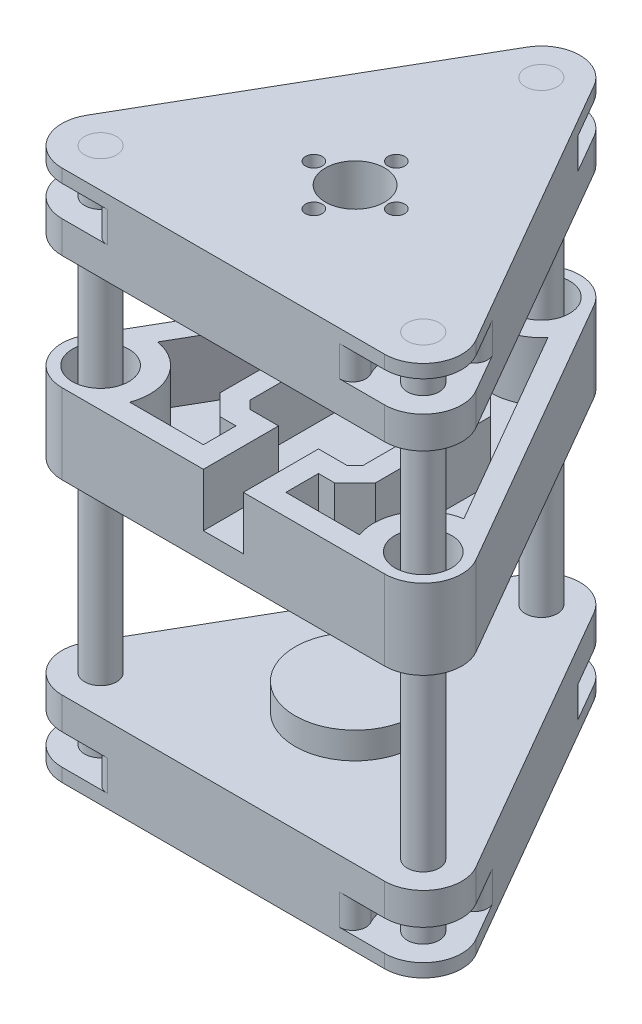
from build123d import *

# Parameters (mm, degrees)
SKETCH1_R             = 6
BOSS_EXTRUDE1_DEPTH   = 5
BOSS_EXTRUDE2_START   = 5
BOSS_EXTRUDE2_DEPTH   = 11.5
BOSS_EXTRUDE6_START   = 16.5
SKETCH1_5_R           = 6
BOSS_EXTRUDE6_DEPTH   = 12
SKETCH1_3_R           = 6
BOSS_EXTRUDE3_DEPTH   = 200
BOSS_EXTRUDE3_2_DEPTH = 200
BOSS_EXTRUDE3_3_DEPTH = 200
FILLET1_START         = 5
FILLET1_DEPTH         = 11.5
SKETCH2_R             = 22.5
BOSS_EXTRUDE4_DEPTH   = 10
SKETCH3_R             = 22.15
SKETCH3_R_2           = 11.15
SKETCH3_R_3           = 3.15
CUT_EXTRUDE1_DEPTH    = 6
SKETCH3_2_R           = 3.15
SKETCH3_2_R_2         = 11.15
CUT_EXTRUDE2_DEPTH    = 206.416118086
SKETCH4_R             = 10.6
BOSS_EXTRUDE7_DEPTH   = 30
SKETCH5_W             = 15
SKETCH5_H             = 28.25
CUT_EXTRUDE3_DEPTH    = 20
CHAMFER1_SIZE         = 3
SHELL2_START          = 106.5
SHELL2_DEPTH          = 22
BOSS_EXTRUDE8_START   = 10
SKETCH6_R             = 22.5
BOSS_EXTRUDE8_DEPTH   = 10


with BuildPart() as part:
    # Sketch1 → Boss-Extrude1 (new body)
    with BuildSketch(Plane(origin=(0, 0, 0), x_dir=(1, 0, 0), z_dir=(0, 1, 0))):
        with BuildLine():
            Line((-12.557368355, 77.25), (-73.17914662, -27.75))
            ThreePointArc((-73.17914662, -27.75), (-73.17914662, -42.25), (-60.621778265, -49.5))
            Line((-60.621778265, -49.5), (60.621778265, -49.5))
            ThreePointArc((60.621778265, -49.5), (73.17914662, -42.25), (73.17914662, -27.75))
            Line((73.17914662, -27.75), (12.557368355, 77.25))
            ThreePointArc((12.557368355, 77.25), (0, 84.5), (-12.557368355, 77.25))
        make_face()
        with Locations(Location((0, 70, 0), (0, 0, 270))):
            Circle(SKETCH1_R, mode=Mode.SUBTRACT)
        with Locations(Location((60.621778265, -35, 0), (0, 0, 270))):
            Circle(SKETCH1_R, mode=Mode.SUBTRACT)
        with Locations(Location((-60.621778265, -35, 0), (0, 0, 270))):
            Circle(SKETCH1_R, mode=Mode.SUBTRACT)
    extrude(amount=BOSS_EXTRUDE1_DEPTH)

    # Sketch1<2> → Boss-Extrude2 (add)
    with BuildSketch(Plane(origin=(0, 0, 0), x_dir=(1, 0, 0), z_dir=(0, 1, 0)).offset(BOSS_EXTRUDE2_START)):
        with BuildLine():
            ThreePointArc((14.5, 70), (-3.752876154, 55.994075519), (-12.557368355, 77.25))
            Line((-12.557368355, 77.25), (-73.17914662, -27.75))
            ThreePointArc((-73.17914662, -27.75), (-56.868902111, -20.994075519), (-46.121778265, -35))
            ThreePointArc((-46.121778265, -35), (-50.368729938, -45.253048327), (-60.621778265, -49.5))
            Line((-60.621778265, -49.5), (60.621778265, -49.5))
            ThreePointArc((60.621778265, -49.5), (48.06440991, -27.75), (73.17914662, -27.75))
            Line((73.17914662, -27.75), (12.557368355, 77.25))
            ThreePointArc((12.557368355, 77.25), (14.005924481, 73.752876154), (14.5, 70))
        make_face()
    extrude(amount=BOSS_EXTRUDE2_DEPTH)

    # Sketch1<5> → Boss-Extrude6 (add)
    with BuildSketch(Plane(origin=(0, 0, 0), x_dir=(1, 0, 0), z_dir=(0, 1, 0)).offset(BOSS_EXTRUDE6_START)):
        with BuildLine():
            Line((-12.557368355, 77.25), (-73.17914662, -27.75))
            ThreePointArc((-73.17914662, -27.75), (-73.17914662, -42.25), (-60.621778265, -49.5))
            Line((-60.621778265, -49.5), (60.621778265, -49.5))
            ThreePointArc((60.621778265, -49.5), (73.17914662, -42.25), (73.17914662, -27.75))
            Line((73.17914662, -27.75), (12.557368355, 77.25))
            ThreePointArc((12.557368355, 77.25), (0, 84.5), (-12.557368355, 77.25))
        make_face()
        with Locations(Location((0, 70, 0), (0, 0, 270))):
            Circle(SKETCH1_5_R, mode=Mode.SUBTRACT)
        with Locations(Location((60.621778265, -35, 0), (0, 0, 270))):
            Circle(SKETCH1_5_R, mode=Mode.SUBTRACT)
        with Locations(Location((-60.621778265, -35, 0), (0, 0, 270))):
            Circle(SKETCH1_5_R, mode=Mode.SUBTRACT)
    extrude(amount=BOSS_EXTRUDE6_DEPTH)

    # Fillet1: read off the stored shape, not the designer's step
    # Fillet1 outline → Fillet1 (cut)
    with BuildSketch(Plane(origin=(0, 0, 0), x_dir=(1, 0, 0), z_dir=(0, 1, 0)).offset(FILLET1_START)):
        with BuildLine():
            ThreePointArc((60.621778265, -49.5), (53.279417854, -47.503589228), (47.958901224, -42.064102564))
            ThreePointArc((47.958901224, -42.064102564), (47.903974391, -47.031848418), (43.592391899, -49.5))
            Line((43.592391899, -49.5), (60.621778265, -49.5))
        make_face()
        with BuildLine():
            ThreePointArc((64.664453437, -13.002118796), (64.682762712, -17.970134556), (60.40803202, -20.501575515))
            ThreePointArc((60.40803202, -20.501575515), (67.77902397, -22.389534746), (73.17914662, -27.75))
            Line((73.17914662, -27.75), (64.664453437, -13.002118796))
        make_face()
        with BuildLine():
            Line((-60.621778265, -49.5), (-43.592391899, -49.5))
            ThreePointArc((-43.592391899, -49.5), (-47.903974391, -47.031848418), (-47.958901224, -42.064102564))
            ThreePointArc((-47.958901224, -42.064102564), (-53.279417854, -47.503589228), (-60.621778265, -49.5))
        make_face()
        with BuildLine():
            ThreePointArc((12.449130796, 62.565678079), (16.778788321, 65.001982974), (21.072061538, 62.502118796))
            Line((21.072061538, 62.502118796), (12.557368355, 77.25))
            ThreePointArc((12.557368355, 77.25), (14.499606116, 69.893123974), (12.449130796, 62.565678079))
        make_face()
        with BuildLine():
            ThreePointArc((-73.17914662, -27.75), (-67.77902397, -22.389534746), (-60.40803202, -20.501575515))
            ThreePointArc((-60.40803202, -20.501575515), (-64.682762712, -17.970134556), (-64.664453437, -13.002118796))
            Line((-64.664453437, -13.002118796), (-73.17914662, -27.75))
        make_face()
        with BuildLine():
            ThreePointArc((-21.072061538, 62.502118796), (-16.778788321, 65.001982974), (-12.449130796, 62.565678079))
            ThreePointArc((-12.449130796, 62.565678079), (-14.499606116, 69.893123974), (-12.557368355, 77.25))
            Line((-12.557368355, 77.25), (-21.072061538, 62.502118796))
        make_face()
    extrude(amount=FILLET1_DEPTH, mode=Mode.SUBTRACT)


with BuildPart() as body_2:
    # Sketch1<3> → Boss-Extrude3 (new body)
    with BuildSketch(Plane(origin=(0, 0, 0), x_dir=(1, 0, 0), z_dir=(0, 1, 0))):
        with Locations(Location((0, 70, 0), (0, 0, 270))):
            Circle(SKETCH1_3_R)
    extrude(amount=BOSS_EXTRUDE3_DEPTH)


with BuildPart() as body_3:
    # Sketch1<3> → Boss-Extrude3 2 (new body)
    with BuildSketch(Plane(origin=(0, 0, 0), x_dir=(1, 0, 0), z_dir=(0, 1, 0))):
        with Locations(Location((60.621778265, -35, 0), (0, 0, 270))):
            Circle(SKETCH1_3_R)
    extrude(amount=BOSS_EXTRUDE3_2_DEPTH)


with BuildPart() as body_4:
    # Sketch1<3> → Boss-Extrude3 3 (new body)
    with BuildSketch(Plane(origin=(0, 0, 0), x_dir=(1, 0, 0), z_dir=(0, 1, 0))):
        with Locations(Location((-60.621778265, -35, 0), (0, 0, 270))):
            Circle(SKETCH1_3_R)
    extrude(amount=BOSS_EXTRUDE3_3_DEPTH)


with BuildPart() as body_5:
    # Mirror1: mirrored copy
    add(part.part.mirror(Plane.ZX.offset(100)))

    # Sketch3 → Cut-Extrude1 (cut)
    with BuildSketch(Plane.XZ.offset(-171.5)):
        with Locations(Location((0, 0, 0), (0, 0, 270))):
            Circle(SKETCH3_R)
        with Locations(Location((0, 0, 0), (0, 0, 270))):
            Circle(SKETCH3_R_2, mode=Mode.SUBTRACT)
        with Locations(Location((0, 15.5, 0), (0, 0, 270))):
            Circle(SKETCH3_R_3, mode=Mode.SUBTRACT)
        with Locations(Location((15.5, 0, 0), (0, 0, 270))):
            Circle(SKETCH3_R_3, mode=Mode.SUBTRACT)
        with Locations(Location((0, -15.5, 0), (0, 0, 270))):
            Circle(SKETCH3_R_3, mode=Mode.SUBTRACT)
        with Locations(Location((-15.5, 0, 0), (0, 0, 270))):
            Circle(SKETCH3_R_3, mode=Mode.SUBTRACT)
    extrude(amount=-CUT_EXTRUDE1_DEPTH, mode=Mode.SUBTRACT)

    # Sketch3<2> → Cut-Extrude2 (cut, through all)
    with BuildSketch(Plane.XZ.offset(-171.5)):
        with Locations(Location((-15.5, 0, 0), (0, 0, 270))):
            Circle(SKETCH3_2_R)
        with Locations(Location((0, -15.5, 0), (0, 0, 270))):
            Circle(SKETCH3_2_R)
        with Locations(Location((15.5, 0, 0), (0, 0, 270))):
            Circle(SKETCH3_2_R)
        with Locations(Location((0, 0, 0), (0, 0, 270))):
            Circle(SKETCH3_2_R_2)
        with Locations(Location((0, 15.5, 0), (0, 0, 270))):
            Circle(SKETCH3_2_R)
    extrude(amount=-CUT_EXTRUDE2_DEPTH, mode=Mode.SUBTRACT)


with BuildPart() as part_1:
    add(part.part)

    # Sketch2 → Boss-Extrude4 (add)
    with BuildSketch(Plane(origin=(0, 28.5, 0), x_dir=(1, 0, 0), z_dir=(0, 1, 0))):
        with Locations(Location((0, 0, 0), (0, 0, 270))):
            Circle(SKETCH2_R)
    extrude(amount=BOSS_EXTRUDE4_DEPTH)


with BuildPart() as body_6:
    # Sketch4 → Boss-Extrude7 (new body)
    with BuildSketch(Plane(origin=(0, 98.5, 0), x_dir=(1, 0, 0), z_dir=(0, 1, 0))):
        with BuildLine():
            Line((-12.557368355, 77.25), (-73.17914662, -27.75))
            ThreePointArc((-73.17914662, -27.75), (-73.17914662, -42.25), (-60.621778265, -49.5))
            Line((-60.621778265, -49.5), (60.621778265, -49.5))
            ThreePointArc((60.621778265, -49.5), (73.17914662, -42.25), (73.17914662, -27.75))
            Line((73.17914662, -27.75), (12.557368355, 77.25))
            ThreePointArc((12.557368355, 77.25), (0, 84.5), (-12.557368355, 77.25))
        make_face()
        with Locations(Location((0, 70, 0), (0, 0, 270))):
            Circle(SKETCH4_R, mode=Mode.SUBTRACT)
        with Locations(Location((-60.621778265, -35, 0), (0, 0, 270))):
            Circle(SKETCH4_R, mode=Mode.SUBTRACT)
        with Locations(Location((60.621778265, -35, 0), (0, 0, 270))):
            Circle(SKETCH4_R, mode=Mode.SUBTRACT)
    extrude(amount=BOSS_EXTRUDE7_DEPTH)

    # Sketch5 → Cut-Extrude3 (cut)
    with BuildSketch(Plane(origin=(0, 128.5, 0), x_dir=(1, 0, 0), z_dir=(0, 1, 0))):
        Polygon((-21.25, -21.25), (21.25, -21.25), (-21.25, 21.25), align=None)
        Polygon((21.25, -21.25), (-21.25, 21.25), (21.25, 21.25), align=None)
        with Locations((0, -35.375)):
            Rectangle(SKETCH5_W, SKETCH5_H)
    extrude(amount=-CUT_EXTRUDE3_DEPTH, mode=Mode.SUBTRACT)

    # Chamfer1
    chamfer1_edges = [body_6.edges().sort_by_distance(p)[0] for p in [
        (-21.25, 118.5, 21.25),
        (-21.25, 118.5, -21.25),
        (21.25, 118.5, -21.25),
        (21.25, 118.5, 21.25),
    ]]
    chamfer(chamfer1_edges, length=CHAMFER1_SIZE)

    # Shell2: read off the stored shape, not the designer's step
    # Shell2 outline → Shell2 (cut)
    with BuildSketch(Plane(origin=(0, 0, 0), x_dir=(1, 0, 0), z_dir=(0, 1, 0)).offset(SHELL2_START)):
        with BuildLine():
            Line((-21.563708499, 29.25), (21.563708499, 29.25))
            Line((21.563708499, 29.25), (29.25, 21.563708499))
            Line((29.25, 21.563708499), (29.25, -21.563708499))
            Line((29.25, -21.563708499), (21.563708499, -29.25))
            Line((21.563708499, -29.25), (15.5, -29.25))
            Line((15.5, -29.25), (15.5, -41.5))
            Line((15.5, -41.5), (43.194500795, -41.5))
            ThreePointArc((43.194500795, -41.5), (44.513705755, -25.7), (57.537304655, -16.657534993))
            Line((57.537304655, -16.657534993), (14.342803859, 58.157534993))
            ThreePointArc((14.342803859, 58.157534993), (0, 51.4), (-14.342803859, 58.157534993))
            Line((-14.342803859, 58.157534993), (-57.537304655, -16.657534993))
            ThreePointArc((-57.537304655, -16.657534993), (-44.513705755, -25.7), (-43.194500795, -41.5))
            Line((-43.194500795, -41.5), (-15.5, -41.5))
            Line((-15.5, -41.5), (-15.5, -29.25))
            Line((-15.5, -29.25), (-21.563708499, -29.25))
            Line((-21.563708499, -29.25), (-29.25, -21.563708499))
            Line((-29.25, -21.563708499), (-29.25, 21.563708499))
            Line((-29.25, 21.563708499), (-21.563708499, 29.25))
        make_face()
    extrude(amount=SHELL2_DEPTH, mode=Mode.SUBTRACT)

    # Sketch6 → Boss-Extrude8 (add)
    with BuildSketch(Plane.XZ.offset(-98.5).offset(BOSS_EXTRUDE8_START)):
        with Locations(Location((0, 0, 0), (0, 0, 90))):
            Circle(SKETCH6_R)
    extrude(amount=-BOSS_EXTRUDE8_DEPTH)


solid = Compound([body_2.part, body_3.part, body_4.part, body_5.part, part_1.part, body_6.part])
